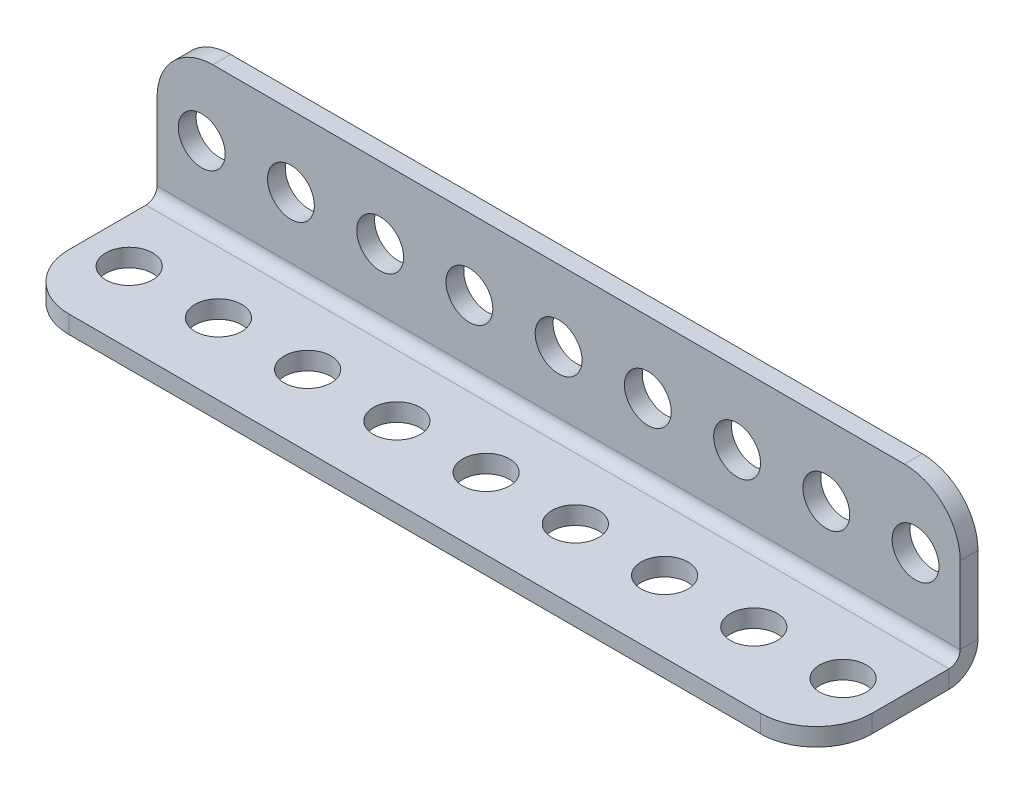
from build123d import *

# Parameters (mm, degrees)
BASE_FLANGE1_DEPTH = 72
FILLET1_R          = 5
SKETCH6_R          = 2.1
CUT_EXTRUDE1_DEPTH = 75.569833043
SKETCH7_R          = 2.1
CUT_EXTRUDE2_DEPTH = 75.569833043
LPATTERN1_COUNT    = 9
LPATTERN1_PITCH    = 8


# Sheet-metal steps are written as plain solids
with BuildPart() as part:
    # Sketch1 → Base-Flange1 (new body)
    with BuildSketch(Plane(origin=(0, 0, 0), x_dir=(0, 0, -1), z_dir=(1, 0, 0))):
        with BuildLine():
            Line((0, 14.5), (0, 2.6))
            ThreePointArc((0, 2.6), (-0.761522369, 0.761522369), (-2.6, 0))
            Line((-2.6, 0), (-14.5, 0))
            Line((-14.5, 0), (-14.5, 1.6))
            Line((-14.5, 1.6), (-2.6, 1.6))
            ThreePointArc((-2.6, 1.6), (-1.892893219, 1.892893219), (-1.6, 2.6))
            Line((-1.6, 2.6), (-1.6, 14.5))
            Line((-1.6, 14.5), (0, 14.5))
        make_face()
    extrude(amount=BASE_FLANGE1_DEPTH)

    # Fillet1
    fillet1_edges = [part.edges().sort_by_distance(p)[0] for p in [
        (72, 14.5, 0.8),
        (72, 0.8, 14.5),
        (0, 14.5, 0.8),
        (0, 0.8, 14.5),
    ]]
    fillet(fillet1_edges, radius=FILLET1_R)

    # Sketch6 → Cut-Extrude1 (cut, through all)
    with BuildSketch(Plane.XY.offset(1.6)):
        with Locations((4, 8.1)):
            Circle(SKETCH6_R)
    cut_extrude1 = extrude(amount=-CUT_EXTRUDE1_DEPTH, mode=Mode.SUBTRACT)

    # Sketch7 → Cut-Extrude2 (cut, through all)
    with BuildSketch(Plane(origin=(0, 1.6, 0), x_dir=(1, 0, 0), z_dir=(0, 1, 0))):
        with Locations(Location((4, -8.1, 0), (0, 0, 270))):
            Circle(SKETCH7_R)
    cut_extrude2 = extrude(amount=-CUT_EXTRUDE2_DEPTH, mode=Mode.SUBTRACT)

    # LPattern1: Cut-Extrude1, Cut-Extrude2 ×9
    with Locations(*[(i * LPATTERN1_PITCH, 0, 0) for i in range(1, LPATTERN1_COUNT)]):
        add(cut_extrude1, mode=Mode.SUBTRACT)
        add(cut_extrude2, mode=Mode.SUBTRACT)


solid = part.part
